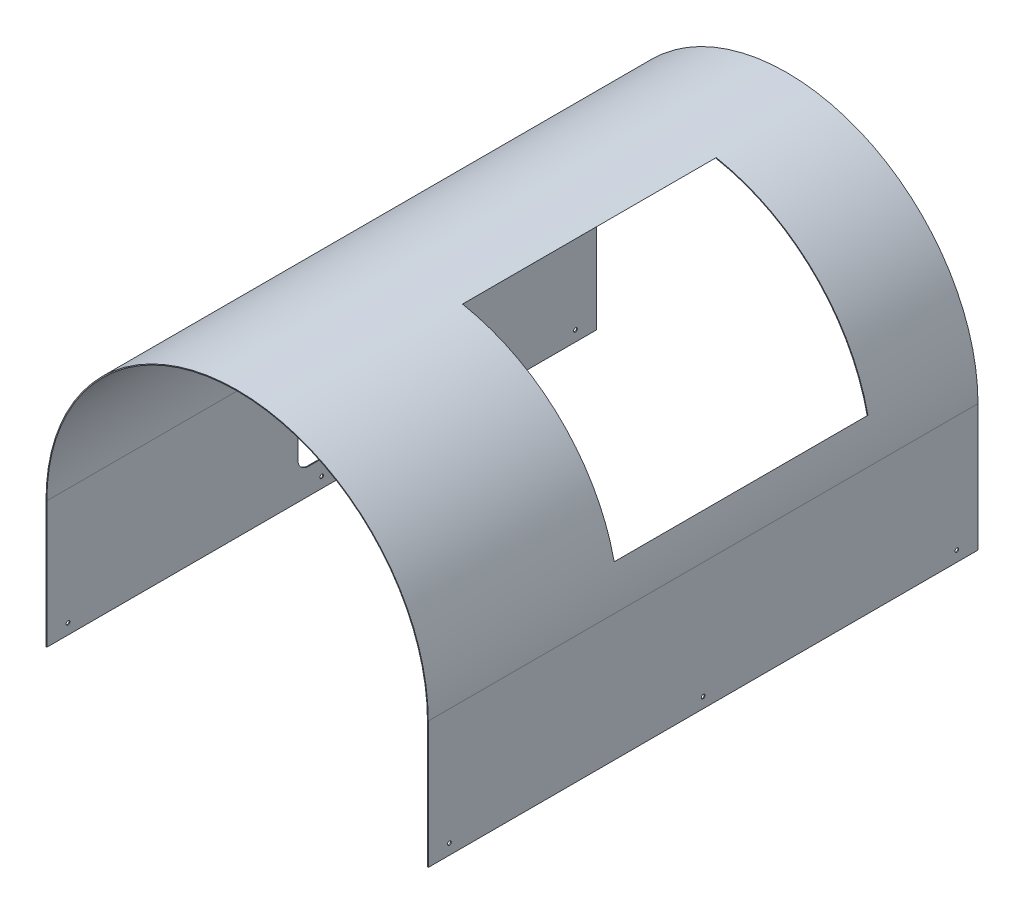
from build123d import *

# Parameters (mm, degrees)
BOSS_EXTRUDE1_DEPTH   = 660.4
CUT_EXTRUDE1_DEPTH    = 660.4
SKETCH3_W             = 254
SKETCH3_H             = 304.8
CUT_EXTRUDE2_DEPTH    = 152.4
CUT_EXTRUDE3_DEPTH    = 2.54
F_8_CLEARANCE_HOLE1_D = 4.4958


with BuildPart() as part:
    # Sketch1 → Boss-Extrude1 (new body)
    with BuildSketch(Plane.XY):
        with BuildLine():
            Line((-228.6, -36.83), (-228.6, -189.23))
            Line((-228.6, -189.23), (230.632, -189.23))
            Line((230.632, -189.23), (230.632, -36.83))
            ThreePointArc((230.632, -36.83), (1.016, 192.786), (-228.6, -36.83))
        make_face()
    extrude(amount=BOSS_EXTRUDE1_DEPTH)

    # Sketch2 → Cut-Extrude1 (cut)
    with BuildSketch(Plane.XY.offset(660.4)):
        with BuildLine():
            Line((-227.584, -36.83), (-227.584, -189.23))
            Line((-227.584, -189.23), (229.616, -189.23))
            Line((229.616, -189.23), (229.616, -36.83))
            ThreePointArc((229.616, -36.83), (1.016, 191.77), (-227.584, -36.83))
        make_face()
    extrude(amount=-CUT_EXTRUDE1_DEPTH, mode=Mode.SUBTRACT)

    # Sketch3 → Cut-Extrude2 (cut)
    with BuildSketch(Plane(origin=(96.389804427, 96.818203557, 0), x_dir=(0.7086729033899728, -0.7055371825785132, 0), z_dir=(0.7055371825785132, 0.7086729033899728, 0))):
        with Locations((24.327583489, -279.4)):
            Rectangle(SKETCH3_W, SKETCH3_H)
    extrude(amount=CUT_EXTRUDE2_DEPTH, mode=Mode.SUBTRACT)

    # Sketch4 → Cut-Extrude3 (cut)
    with BuildSketch(Plane.ZY.offset(228.6)):
        with BuildLine():
            Line((183.515, -65.405), (346.075, -65.405))
            ThreePointArc((346.075, -65.405), (355.055256121, -69.124743879), (358.775, -78.105))
            Line((358.775, -78.105), (358.775, -145.415))
            ThreePointArc((358.775, -145.415), (355.055256121, -154.395256121), (346.075, -158.115))
            Line((346.075, -158.115), (183.515, -158.115))
            ThreePointArc((183.515, -158.115), (174.534743879, -154.395256121), (170.815, -145.415))
            Line((170.815, -145.415), (170.815, -78.105))
            ThreePointArc((170.815, -78.105), (174.534743879, -69.124743879), (183.515, -65.405))
        make_face()
    extrude(amount=-CUT_EXTRUDE3_DEPTH, mode=Mode.SUBTRACT)

    # #8 Clearance Hole1 (through all)
    with Locations(Plane(origin=(230.632, 0, 0), x_dir=(0, 0, -1), z_dir=(1, 0, 0))):
        with Locations((-635, -176.53), (-330.2, -176.53), (-25.4, -176.53)):
            Hole(F_8_CLEARANCE_HOLE1_D / 2)


solid = part.part
